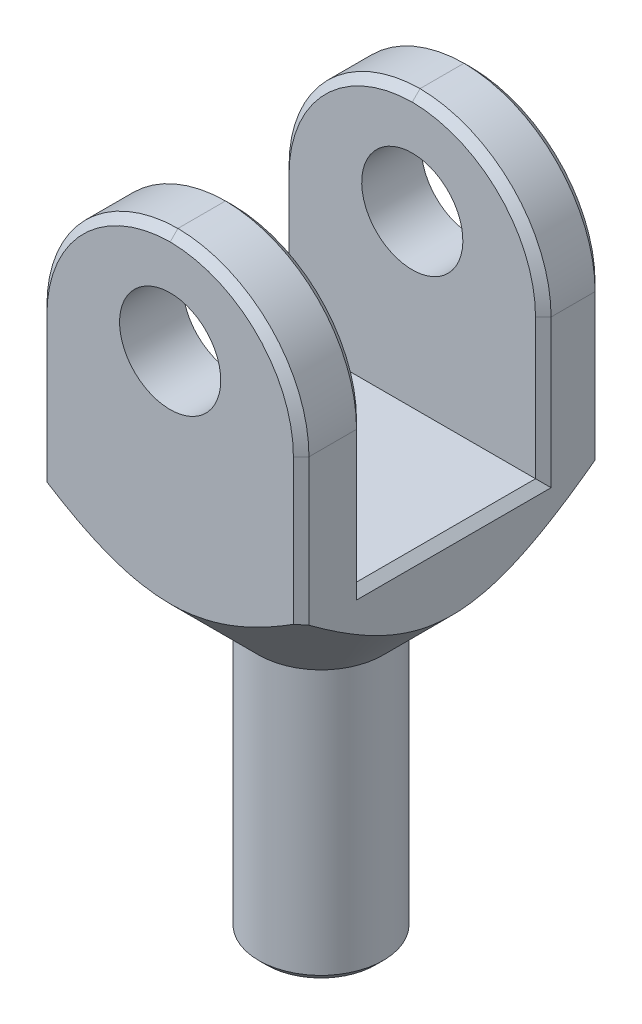
from build123d import *

# Parameters (mm, degrees)
SKETCH1_R               = 80
BOSS_EXTRUDE1_DEPTH     = 350
CUT_EXTRUDE1_DEPTH      = 280
CUT_EXTRUDE1_DEPTH_BACK = 280
SKETCH3_W               = 88.388347649
SKETCH3_H               = 547.119919447
CUT_EXTRUDE2_DEPTH      = 280
CUT_EXTRUDE2_DEPTH_BACK = 280
SKETCH4_W               = 78.896856421
SKETCH4_H               = 529.725466083
SKETCH7_W               = 230
SKETCH7_H               = 350
CUT_EXTRUDE5_DEPTH      = 400
FILLET1_R               = 170
SKETCH8_R               = 65
CUT_EXTRUDE6_DEPTH      = 512
CHAMFER1_SIZE           = 10


with BuildPart() as part:
    # Sketch1 → Boss-Extrude1 (new body)
    with BuildSketch(Plane(origin=(0, 0, 0), x_dir=(1, 0, 0), z_dir=(0, 1, 0))):
        with Locations(Location((0, 0, 0), (0, 0, 270))):
            Circle(SKETCH1_R)
    extrude(amount=BOSS_EXTRUDE1_DEPTH)

    # Sketch2 → Revolve1 (revolve)
    with BuildSketch(Plane.XY, mode=Mode.PRIVATE) as revolve1_sk:
        Polygon((-80, 350), (-256.776695297, 526.776695297), (-256.776695297, 876.776695297), (0, 876.776695297), (0, 350), align=None)
    revolve(revolve1_sk.sketch.rotate(Axis((0, 876.776695297, 0), (0, -1, 0)), 270), axis=Axis((0, 876.776695297, 0), (0, -1, 0)))

    # Sketch3 → Cut-Extrude1 (cut, two sides: drawn at the far end of the back side and taken through both)
    with BuildSketch(Plane.XY.offset(-CUT_EXTRUDE1_DEPTH_BACK)):
        with Locations((-212.582521472, 623.559959724)):
            Rectangle(SKETCH3_W, SKETCH3_H)
        with Locations((212.582521472, 623.559959724)):
            Rectangle(SKETCH3_W, SKETCH3_H)
    extrude(amount=CUT_EXTRUDE1_DEPTH + CUT_EXTRUDE1_DEPTH_BACK, mode=Mode.SUBTRACT)

    # Sketch4 → Cut-Extrude2 (cut, two sides: drawn at the far end of the back side and taken through both)
    with BuildSketch(Plane(origin=(0, 0, 0), x_dir=(0, 0, -1), z_dir=(1, 0, 0)).offset(-CUT_EXTRUDE2_DEPTH_BACK)):
        with Locations((-233.30310477, 611.913962256)):
            Rectangle(SKETCH4_W, SKETCH4_H)
        with Locations((233.30310477, 611.913962256)):
            Rectangle(SKETCH4_W, SKETCH4_H)
    extrude(amount=CUT_EXTRUDE2_DEPTH + CUT_EXTRUDE2_DEPTH_BACK, mode=Mode.SUBTRACT)

    # Sketch7 → Cut-Extrude5 (cut)
    with BuildSketch(Plane(origin=(168.388347648, 0, 0), x_dir=(0, 0, -1), z_dir=(1, 0, 0))):
        with Locations((2.308668657, 701.776695297)):
            Rectangle(SKETCH7_W, SKETCH7_H)
    extrude(amount=-CUT_EXTRUDE5_DEPTH, mode=Mode.SUBTRACT)

    # Fillet1
    # the kernel refuses this fillet: 170 mm, written as the material it takes off along each edge
    with BuildSketch(Plane(origin=(-168.388347648, 876.776695297, -312.308668657), x_dir=(0, -1, 0), z_dir=(0, 0, 1))) as fillet1_piece_1:
        with BuildLine():
            CenterArc((FILLET1_R, FILLET1_R), FILLET1_R, 180, 90)
            Line((0, FILLET1_R), (0, 0))
            Line((0, 0), (FILLET1_R, 0))
        make_face()
    extrude(amount=931.163345216, mode=Mode.SUBTRACT)
    with BuildSketch(Plane(origin=(-168.388347648, 876.776695297, -618.854676559), x_dir=(0, -1, 0), z_dir=(0, 0, 1))) as fillet1_piece_2:
        with BuildLine():
            CenterArc((FILLET1_R, FILLET1_R), FILLET1_R, 180, 90)
            Line((0, FILLET1_R), (0, 0))
            Line((0, 0), (FILLET1_R, 0))
        make_face()
    extrude(amount=926.546007901, mode=Mode.SUBTRACT)
    with BuildSketch(Plane(origin=(168.388347648, 876.776695297, -618.854676559), x_dir=(0, -1, 0), z_dir=(0, 0, 1))) as fillet1_piece_3:
        with BuildLine():
            CenterArc((FILLET1_R, -FILLET1_R), FILLET1_R, 90, 90)
            Line((0, -FILLET1_R), (0, 0))
            Line((0, 0), (FILLET1_R, 0))
        make_face()
    extrude(amount=926.546007901, mode=Mode.SUBTRACT)
    with BuildSketch(Plane(origin=(168.388347648, 876.776695297, -312.308668657), x_dir=(0, -1, 0), z_dir=(0, 0, 1))) as fillet1_piece_4:
        with BuildLine():
            CenterArc((FILLET1_R, -FILLET1_R), FILLET1_R, 90, 90)
            Line((0, -FILLET1_R), (0, 0))
            Line((0, 0), (FILLET1_R, 0))
        make_face()
    extrude(amount=931.163345216, mode=Mode.SUBTRACT)

    # Sketch8 → Cut-Extrude6 (cut)
    with BuildSketch(Plane.XY.offset(193.854676559)):
        with Locations(Location((0, 745.076791734, 0), (0, 0, 90))):
            Circle(SKETCH8_R)
    extrude(amount=-CUT_EXTRUDE6_DEPTH, mode=Mode.SUBTRACT)

    # Chamfer1
    # the kernel refuses this chamfer: 10 mm, written as the material it takes off along each edge
    with BuildSketch(Plane(origin=(-168.388347648, 501.059864817, 193.854676559), x_dir=(0.9996219169112968, 0, 0.027495876610587663), z_dir=(0, 1, 0)), Plane(origin=(168.388347648, 501.059864817, -193.854676559), x_dir=(-0.9996219169112968, 0, -0.027495876610587663), z_dir=(0, 1, 0)), Plane(origin=(-168.388347648, 501.059864817, -193.854676559), x_dir=(-0.027495876610587663, 0, 0.9996219169112968), z_dir=(0, 1, 0))) as chamfer1_piece_1:
        Polygon((CHAMFER1_SIZE * 0.999621916911, CHAMFER1_SIZE * 0.0274958766106), (-CHAMFER1_SIZE * 0.0274958766106, CHAMFER1_SIZE * 0.999621916911), (0, 0), align=None)
    extrude(amount=205.71683048, mode=Mode.SUBTRACT)
    with BuildSketch(Plane(origin=(1.611652352, 706.776695297, 193.854676559), x_dir=(-1, 0, 0), z_dir=(0, -1, 0))) as chamfer1_piece_2:
        Polygon((170 - CHAMFER1_SIZE, 0), (170, CHAMFER1_SIZE), (170, 0), align=None)
    revolve(axis=Axis((1.611652352, 706.776695297, 193.854676559), (0, 0, -1)), revolution_arc=89.456810229, mode=Mode.SUBTRACT)
    with BuildSketch(Plane(origin=(-1.611652352, 706.776695297, 193.854676559), x_dir=(0.009480307950975276, 0.9999550608708146, 0), z_dir=(-0.9999550608708146, 0.009480307950975276, 0))) as chamfer1_piece_3:
        Polygon((170 - CHAMFER1_SIZE, 0), (170, CHAMFER1_SIZE), (170, 0), align=None)
    revolve(axis=Axis((-1.611652352, 706.776695297, 193.854676559), (0, 0, -1)), revolution_arc=89.456810229, mode=Mode.SUBTRACT)
    with BuildSketch(Plane(origin=(168.388347648, 501.059864817, 193.854676559), x_dir=(-0.9996219169112968, 0, 0.027495876610587663), z_dir=(0, 1, 0))) as chamfer1_piece_4:
        Polygon((CHAMFER1_SIZE * 0.999621916911, -CHAMFER1_SIZE * 0.0274958766106), (-CHAMFER1_SIZE * 0.0274958766106, -CHAMFER1_SIZE * 0.999621916911), (0, 0), align=None)
    extrude(amount=205.71683048, mode=Mode.SUBTRACT)
    with BuildSketch(Plane(origin=(-168.388347648, 706.776695297, 112.691331343), x_dir=(-0.0274958766105877, 0, 0.9996219169112968), z_dir=(0, -1, 0)), Plane(origin=(-168.388347648, 526.776695297, -117.308668657), x_dir=(-0.0274958766105877, 0, -0.9996219169112968), z_dir=(0, 1, 0))) as chamfer1_piece_5:
        Polygon((CHAMFER1_SIZE * 0.999621916911, -CHAMFER1_SIZE * 0.0274958766106), (-CHAMFER1_SIZE * 0.0274958766106, -CHAMFER1_SIZE * 0.999621916911), (0, 0), align=None)
    extrude(amount=180, mode=Mode.SUBTRACT)
    with BuildSketch(Plane(origin=(1.611652352, 706.776695297, 112.691331343), x_dir=(-1, 0, 0), z_dir=(0, -1, 0))) as chamfer1_piece_6:
        Polygon((170, -CHAMFER1_SIZE), (170 - CHAMFER1_SIZE, 0), (170, 0), align=None)
    revolve(axis=Axis((1.611652352, 706.776695297, 112.691331343), (0, 0, -1)), revolution_arc=89.456810229, mode=Mode.SUBTRACT)
    with BuildSketch(Plane(origin=(-1.611652352, 706.776695297, 112.691331343), x_dir=(0.009480307950975276, 0.9999550608708146, 0), z_dir=(-0.9999550608708146, 0.009480307950975276, 0))) as chamfer1_piece_7:
        Polygon((170, -CHAMFER1_SIZE), (170 - CHAMFER1_SIZE, 0), (170, 0), align=None)
    revolve(axis=Axis((-1.611652352, 706.776695297, 112.691331343), (0, 0, -1)), revolution_arc=89.456810229, mode=Mode.SUBTRACT)
    with BuildSketch(Plane(origin=(1.611652352, 706.776695297, -117.308668657), x_dir=(-1, 0, 0), z_dir=(0, -1, 0))) as chamfer1_piece_8:
        Polygon((170 - CHAMFER1_SIZE, 0), (170, CHAMFER1_SIZE), (170, 0), align=None)
    revolve(axis=Axis((1.611652352, 706.776695297, -117.308668657), (0, 0, -1)), revolution_arc=89.456810229, mode=Mode.SUBTRACT)
    with BuildSketch(Plane(origin=(-1.611652352, 706.776695297, -117.308668657), x_dir=(0.009480307950975276, 0.9999550608708146, 0), z_dir=(-0.9999550608708146, 0.009480307950975276, 0))) as chamfer1_piece_9:
        Polygon((170 - CHAMFER1_SIZE, 0), (170, CHAMFER1_SIZE), (170, 0), align=None)
    revolve(axis=Axis((-1.611652352, 706.776695297, -117.308668657), (0, 0, -1)), revolution_arc=89.456810229, mode=Mode.SUBTRACT)
    with BuildSketch(Plane(origin=(168.388347648, 706.776695297, 112.691331343), x_dir=(0.0274958766105877, 0, 0.9996219169112968), z_dir=(0, -1, 0)), Plane(origin=(168.388347648, 526.776695297, -117.308668657), x_dir=(0.0274958766105877, 0, -0.9996219169112968), z_dir=(0, 1, 0))) as chamfer1_piece_10:
        Polygon((CHAMFER1_SIZE * 0.999621916911, CHAMFER1_SIZE * 0.0274958766106), (-CHAMFER1_SIZE * 0.0274958766106, CHAMFER1_SIZE * 0.999621916911), (0, 0), align=None)
    extrude(amount=180, mode=Mode.SUBTRACT)
    with BuildSketch(Plane(origin=(168.388347648, 526.776695297, 112.691331343), x_dir=(0.027495876610587815, -0.9996219169112968, 0), z_dir=(0, 0, -1))) as chamfer1_piece_11:
        Polygon((CHAMFER1_SIZE * 0.999621916911, CHAMFER1_SIZE * 0.0274958766106), (-CHAMFER1_SIZE * 0.0274958766106, CHAMFER1_SIZE * 0.999621916911), (0, 0), align=None)
    extrude(amount=230, mode=Mode.SUBTRACT)
    with BuildSketch(Plane(origin=(0, 0, 0), x_dir=(0, 0, 1), z_dir=(-1, 0, 0))) as chamfer1_piece_12:
        Polygon((80, CHAMFER1_SIZE), (80 - CHAMFER1_SIZE, 0), (80, 0), align=None)
    revolve(axis=Axis((0, 0, 0), (0, 1, 0)), mode=Mode.SUBTRACT)
    with BuildSketch(Plane(origin=(-1.611652352, 706.776695297, -193.854676559), x_dir=(0.009480307950975276, 0.9999550608708146, 0), z_dir=(-0.9999550608708146, 0.009480307950975276, 0))) as chamfer1_piece_13:
        Polygon((170 - CHAMFER1_SIZE, 0), (170, -CHAMFER1_SIZE), (170, 0), align=None)
    revolve(axis=Axis((-1.611652352, 706.776695297, -193.854676559), (0, 0, -1)), revolution_arc=89.456810229, mode=Mode.SUBTRACT)
    with BuildSketch(Plane(origin=(1.611652352, 706.776695297, -193.854676559), x_dir=(-1, 0, 0), z_dir=(0, -1, 0))) as chamfer1_piece_14:
        Polygon((170 - CHAMFER1_SIZE, 0), (170, -CHAMFER1_SIZE), (170, 0), align=None)
    revolve(axis=Axis((1.611652352, 706.776695297, -193.854676559), (0, 0, -1)), revolution_arc=89.456810229, mode=Mode.SUBTRACT)
    with BuildSketch(Plane(origin=(168.388347648, 706.776695297, 112.691331343), x_dir=(0.0274958766105877, 0, 0.9996219169112968), z_dir=(0, -1, 0))) as chamfer1_piece_15a_section:
        Polygon((CHAMFER1_SIZE * 0.999621916911, CHAMFER1_SIZE * 0.0274958766106), (-CHAMFER1_SIZE * 0.0274958766106, CHAMFER1_SIZE * 0.999621916911), (0, 0), align=None)
    chamfer1_piece_15a = extrude(amount=205.71682988, mode=Mode.PRIVATE)
    chamfer1_piece_15a = split(chamfer1_piece_15a, bisect_by=Plane(origin=(165.09041138, 526.776695297, 115.989267611), z_dir=(0, -1, 0)), keep=Keep.TOP, mode=Mode.PRIVATE)
    with BuildSketch(Plane(origin=(168.388347648, 526.776695297, 138.408161222), x_dir=(0.027495876610587815, -0.9996219169112968, 0), z_dir=(0, 0, -1))) as chamfer1_piece_15b_section:
        Polygon((CHAMFER1_SIZE * 0.999621916911, CHAMFER1_SIZE * 0.0274958766106), (-CHAMFER1_SIZE * 0.0274958766106, CHAMFER1_SIZE * 0.999621916911), (0, 0), align=None)
    chamfer1_piece_15b = extrude(amount=255.71682988, mode=Mode.PRIVATE)
    chamfer1_piece_15b = split(chamfer1_piece_15b, bisect_by=Plane(origin=(165.09041138, 523.478759029, 112.691331343), z_dir=(0, 0, 1)), keep=Keep.TOP, mode=Mode.PRIVATE)
    chamfer1_piece_15 = chamfer1_piece_15a & chamfer1_piece_15b
    add(chamfer1_piece_15, mode=Mode.SUBTRACT)
    with BuildSketch(Plane(origin=(168.388347648, 526.776695297, 112.691331343), x_dir=(0.027495876610587815, -0.9996219169112968, 0), z_dir=(0, 0, -1))) as chamfer1_piece_16a_section:
        Polygon((CHAMFER1_SIZE * 0.999621916911, CHAMFER1_SIZE * 0.0274958766106), (-CHAMFER1_SIZE * 0.0274958766106, CHAMFER1_SIZE * 0.999621916911), (0, 0), align=None)
    chamfer1_piece_16a = extrude(amount=255.71682988, mode=Mode.PRIVATE)
    chamfer1_piece_16a = split(chamfer1_piece_16a, bisect_by=Plane(origin=(165.09041138, 523.478759029, -117.308668657), z_dir=(0, 0, -1)), keep=Keep.TOP, mode=Mode.PRIVATE)
    with BuildSketch(Plane(origin=(168.388347648, 501.059865417, -117.308668657), x_dir=(0.0274958766105877, 0, -0.9996219169112968), z_dir=(0, 1, 0))) as chamfer1_piece_16b_section:
        Polygon((CHAMFER1_SIZE * 0.999621916911, CHAMFER1_SIZE * 0.0274958766106), (-CHAMFER1_SIZE * 0.0274958766106, CHAMFER1_SIZE * 0.999621916911), (0, 0), align=None)
    chamfer1_piece_16b = extrude(amount=205.71682988, mode=Mode.PRIVATE)
    chamfer1_piece_16b = split(chamfer1_piece_16b, bisect_by=Plane(origin=(165.09041138, 526.776695297, -120.606604925), z_dir=(0, -1, 0)), keep=Keep.TOP, mode=Mode.PRIVATE)
    chamfer1_piece_16 = chamfer1_piece_16a & chamfer1_piece_16b
    add(chamfer1_piece_16, mode=Mode.SUBTRACT)


solid = part.part
